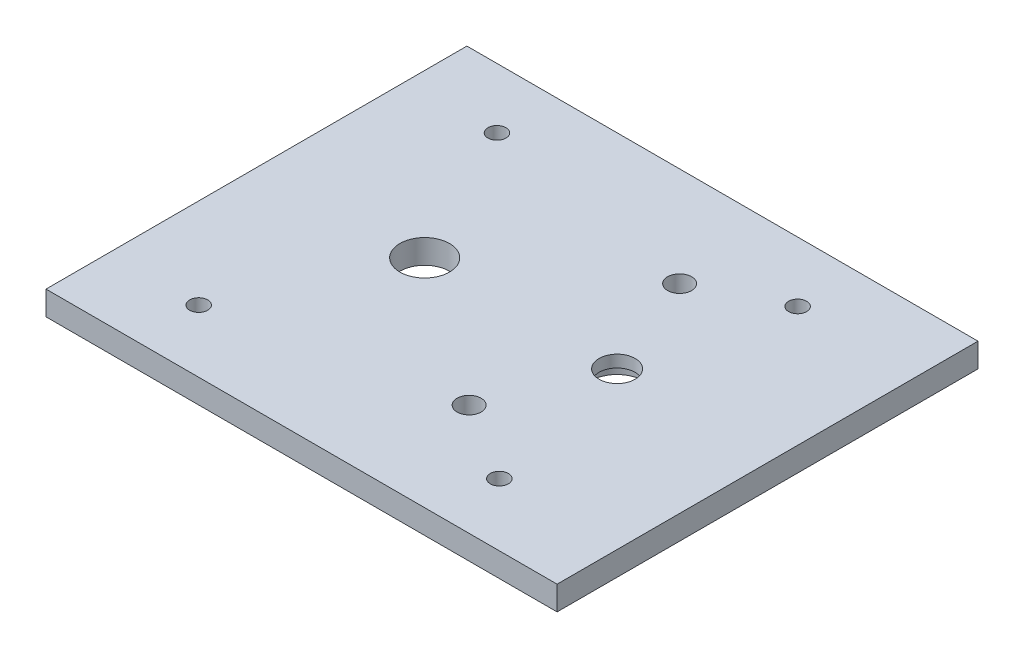
from build123d import *

# Parameters (mm, degrees)
SKETCH1_W           = 85
SKETCH1_H           = 70
SKETCH1_R           = 1.5
SKETCH1_R_2         = 2
SKETCH1_R_3         = 4.125
SKETCH1_R_4         = 3
BOSS_EXTRUDE4_DEPTH = 4
SKETCH1_7_R         = 4.5
CUT_EXTRUDE2_DEPTH  = 2


with BuildPart() as part:
    # Sketch1 → Boss-Extrude4 (new body)
    with BuildSketch(Plane(origin=(0, 0, 0), x_dir=(1, 0, 0), z_dir=(0, 1, 0))):
        Rectangle(SKETCH1_W, SKETCH1_H)
        with Locations((-27.5, -24.60667729)):
            Circle(SKETCH1_R, mode=Mode.SUBTRACT)
        with Locations((22.5, -24.60667729)):
            Circle(SKETCH1_R, mode=Mode.SUBTRACT)
        with Locations((9.401398241, -16.528956449)):
            Circle(SKETCH1_R_2, mode=Mode.SUBTRACT)
        with Locations((-27.5, 25)):
            Circle(SKETCH1_R, mode=Mode.SUBTRACT)
        with Locations((9.407211052, 18.471043068)):
            Circle(SKETCH1_R_2, mode=Mode.SUBTRACT)
        with Locations((22.5, 25)):
            Circle(SKETCH1_R, mode=Mode.SUBTRACT)
        with Locations((-15.52, 1)):
            Circle(SKETCH1_R_3, mode=Mode.SUBTRACT)
        with Locations((16.478339488, 0.999882702)):
            Circle(SKETCH1_R_4, mode=Mode.SUBTRACT)
    extrude(amount=BOSS_EXTRUDE4_DEPTH)

    # Sketch1<7> → Cut-Extrude2 (cut)
    with BuildSketch(Plane(origin=(0, 0, 0), x_dir=(1, 0, 0), z_dir=(0, 1, 0))):
        with Locations((16.478339488, 0.999882702)):
            Circle(SKETCH1_7_R)
    extrude(amount=CUT_EXTRUDE2_DEPTH, mode=Mode.SUBTRACT)


solid = part.part
